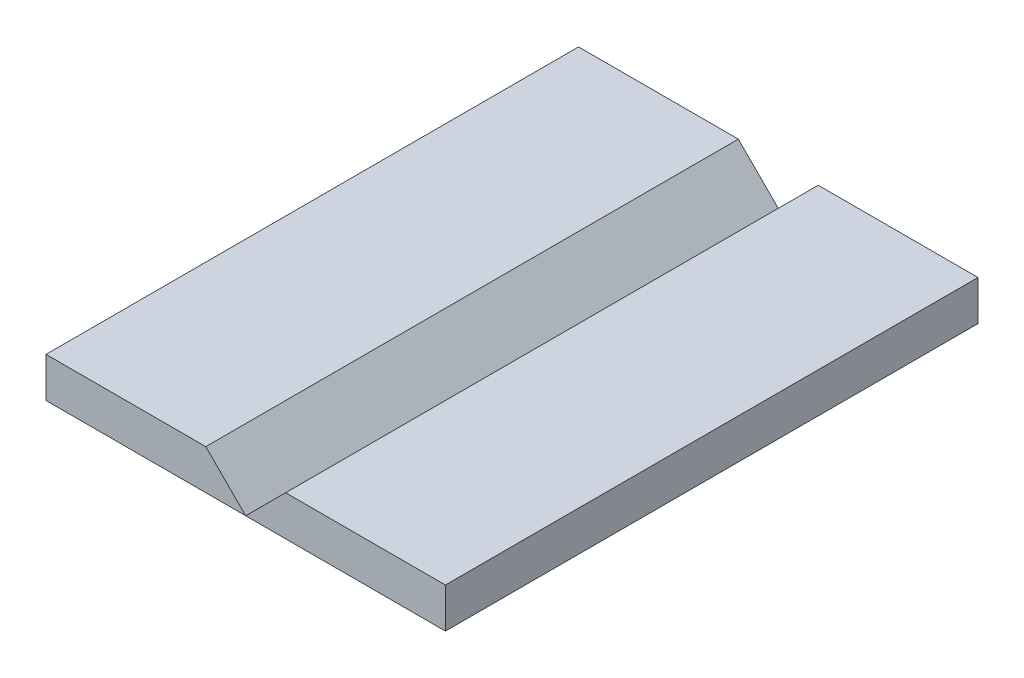
from build123d import *

# Parameters (mm, degrees)
BOSS_EXTRUDE1_DEPTH   = 200
BOSS_EXTRUDE1_2_DEPTH = 200


with BuildPart() as part:
    # Sketch1 → Boss-Extrude1 (new body)
    with BuildSketch(Plane.XY):
        Polygon((0, 15), (0, 0), (75, 0), (60, 15), align=None)
    extrude(amount=BOSS_EXTRUDE1_DEPTH)


with BuildPart() as body_2:
    # Sketch1 → Boss-Extrude1 2 (new body)
    with BuildSketch(Plane.XY):
        Polygon((90, 15), (75, 0), (150, 0), (150, 15), align=None)
    extrude(amount=BOSS_EXTRUDE1_2_DEPTH)


solid = Compound([part.part, body_2.part])
